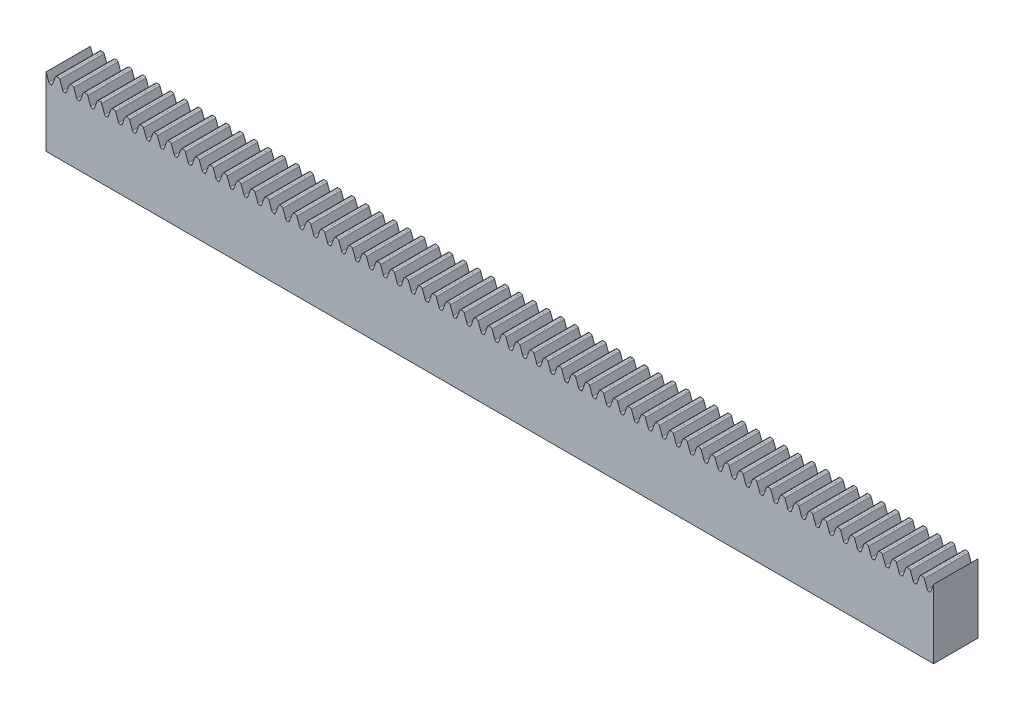
from build123d import *

# Parameters (mm, degrees)
BOSS_EXTRUDE1_DEPTH      = 2.5
BOSS_EXTRUDE1_DEPTH_BACK = 2.5
SKETCH3_W                = 100
SKETCH3_H                = 12
CUT_EXTRUDE1_DEPTH       = 51.420729864
LPATTERN1_COUNT          = 64
LPATTERN1_PITCH          = 1.570796327
LPATTERN1_COUNT_DIR2     = 2
LPATTERN1_PITCH_DIR2     = 1.570796327
SKETCH5_W                = 100
SKETCH5_H                = 4.1
CUT_EXTRUDE2_DEPTH       = 51.606323716


with BuildPart() as part:
    # Sketch3 → Boss-Extrude1 (new, two sides: drawn at the far end of the back side and taken through both)
    with BuildSketch(Plane.XY.offset(-BOSS_EXTRUDE1_DEPTH_BACK)):
        Rectangle(SKETCH3_W, SKETCH3_H)
    extrude(amount=BOSS_EXTRUDE1_DEPTH + BOSS_EXTRUDE1_DEPTH_BACK)

    # Sketch4 → Cut-Extrude1 (cut, symmetric)
    with BuildSketch(Plane.XY):
        with BuildLine():
            Line((-48.945574321, 5.889622222), (-48.905400095, 6))
            Line((-48.905400095, 6), (-49.480084294, 6))
            Line((-49.480084294, 6), (-49.480084294, 4.875))
            Line((-49.480084294, 4.875), (-49.432328186, 4.875))
            ThreePointArc((-49.432328186, 4.875), (-49.336109295, 4.9053377), (-49.274692383, 4.985377778))
            Line((-49.274692383, 4.985377778), (-48.945574321, 5.889622222))
        make_face()
        with BuildLine():
            Line((-48.787938518, 6), (-48.905400095, 6))
            Line((-48.905400095, 6), (-48.945574321, 5.889622222))
            ThreePointArc((-48.945574321, 5.889622222), (-48.884157409, 5.9696623), (-48.787938518, 6))
        make_face()
        with BuildLine():
            Line((-48.44379794, 5.889622222), (-48.483972166, 6))
            Line((-48.483972166, 6), (-48.601433744, 6))
            ThreePointArc((-48.601433744, 6), (-48.505214852, 5.9696623), (-48.44379794, 5.889622222))
        make_face()
        with BuildLine():
            Line((-47.909287967, 4.875), (-47.909287967, 6))
            Line((-47.909287967, 6), (-48.483972166, 6))
            Line((-48.483972166, 6), (-48.44379794, 5.889622222))
            Line((-48.44379794, 5.889622222), (-48.114679878, 4.985377778))
            ThreePointArc((-48.114679878, 4.985377778), (-48.053262966, 4.9053377), (-47.957044075, 4.875))
            Line((-47.957044075, 4.875), (-47.909287967, 4.875))
        make_face()
    cut_extrude1 = extrude(amount=CUT_EXTRUDE1_DEPTH, both=True, mode=Mode.SUBTRACT)

    # LPattern1: Cut-Extrude1 64 × 2
    with Locations(*[Vector(1, 0, 0) * (i * LPATTERN1_PITCH) + Vector(-1, 0, 0) * (j * LPATTERN1_PITCH_DIR2) for i in range(LPATTERN1_COUNT) for j in range(LPATTERN1_COUNT_DIR2) if (i, j) != (0, 0)]):
        add(cut_extrude1, mode=Mode.SUBTRACT)

    # Sketch5 → Cut-Extrude2 (cut, through all)
    with BuildSketch(Plane.XY.offset(2.5)):
        with Locations((0, -3.95)):
            Rectangle(SKETCH5_W, SKETCH5_H)
    extrude(amount=-CUT_EXTRUDE2_DEPTH, mode=Mode.SUBTRACT)


solid = part.part
